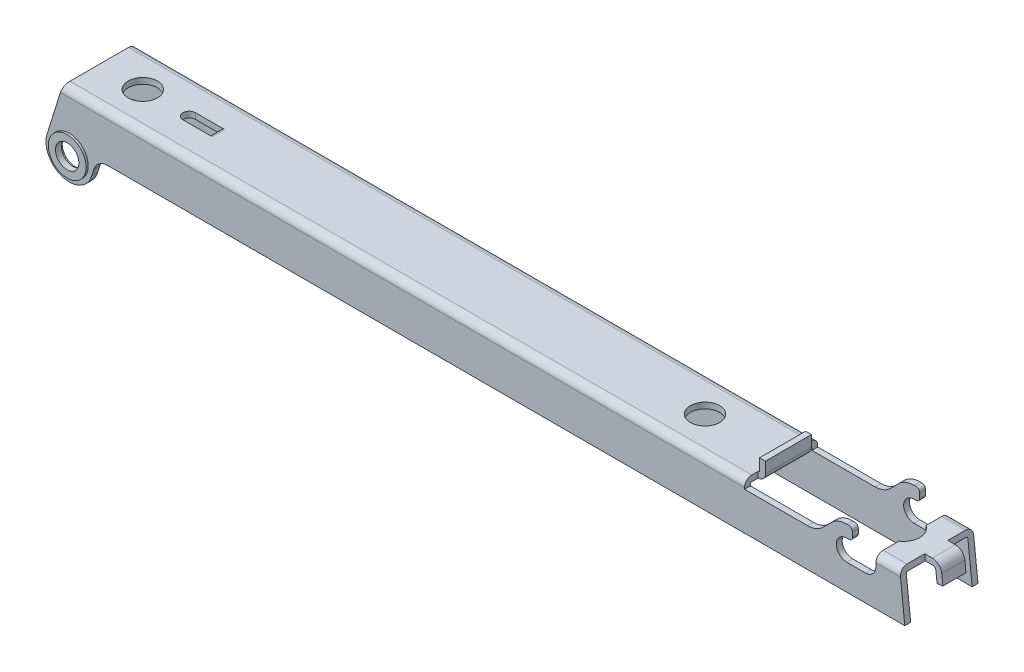
from build123d import *
from OCP.BRepFilletAPI import BRepFilletAPI_MakeFillet

# Parameters (mm, degrees)
BOSS_EXTRUDE1_DEPTH = 6.35
SKETCH2_R           = 3.2766
BOSS_EXTRUDE2_DEPTH = 0.381
FILLET1_R1          = 1.27
FILLET1_R2          = 2.54
SHELL1_T            = -1.016
BOSS_EXTRUDE3_DEPTH = 6.35
FILLET2_R           = 1.27
SHELL2_START        = 118.3386
SHELL2_DEPTH        = 27.813
SHELL2_START_2      = 129.293990182
SHELL2_2_DEPTH      = 7.764409818
FILLET3_R           = 0.635
SKETCH4_R           = 2.032
CUT_EXTRUDE1_DEPTH  = 148.431229717
EXTRUDE_THIN1_DEPTH = 2.0066
CUT_EXTRUDE2_DEPTH  = 150.225017324
EXTRUDE_THIN2_DEPTH = 4.0005
SKETCH8_R           = 2.54
CUT_EXTRUDE3_DEPTH  = 150.217877052
EXTRUDE_THIN3_DEPTH = 1.0795
FILLET4_R           = 0.635
FILLET6_RADIUS      = 1.0795
FILLET6_LENGTH      = 1.016


# Read off the part's stored shape, not the designer's step: Shell2
with BuildPart() as part:
    # Sketch1 → Boss-Extrude1 (new, symmetric)
    with BuildSketch(Plane.XY):
        with BuildLine():
            Line((0, 0), (118.3386, 0))
            Line((118.3386, 0), (118.3386, -8.128))
            Line((118.3386, -8.128), (5.974494608, -8.128))
            Line((5.974494608, -8.128), (5.047186378, -11.093494156))
            ThreePointArc((5.047186378, -11.093494156), (-0.044494156, -13.759386378), (-2.710386378, -8.667705844))
            Line((-2.710386378, -8.667705844), (0, 0))
        make_face()
    extrude(amount=BOSS_EXTRUDE1_DEPTH, both=True)

    # Sketch2 → Boss-Extrude2 (add)
    with BuildSketch(Plane.XY.offset(6.35)):
        with Locations(Location((1.1684, -9.8806, 0), (0, 0, 180))):
            Circle(SKETCH2_R)
    boss_extrude2 = extrude(amount=BOSS_EXTRUDE2_DEPTH)

    # Mirror1: Boss-Extrude2 across plane
    add(boss_extrude2.mirror(Plane.XY))

    # Fillet1: one fillet with a radius per group of edges: ONE call of the kernel's fillet builder (fillet() takes one radius for all edges)
    fillet1_edges_1 = [part.edges().sort_by_distance(p)[0] for p in [
        (59.1693, 0, 6.35),
        (59.1693, 0, -6.35),
    ]]
    fillet1_edges_2 = [part.edges().sort_by_distance(p)[0] for p in [
        (5.974494608, -8.128, 0),
    ]]
    fillet1 = BRepFilletAPI_MakeFillet(part.part.solid().wrapped)
    for e in fillet1_edges_1:
        fillet1.Add(FILLET1_R1, e.wrapped)
    for e in fillet1_edges_2:
        fillet1.Add(FILLET1_R2, e.wrapped)
    add(Compound.cast(fillet1.Shape()), mode=Mode.REPLACE)

    # Shell1
    shell1_openings = [part.faces().sort_by_distance(p)[0] for p in [
        (118.3386, -4.089523172, 0),
        (63.090062087, -8.128, 0),
        (5.232234532, -10.501717654, 0),
        (-0.044494156, -13.759386378, 0),
        (-1.363208192, -4.359484576, 0),
        (6.337175389, -8.621408996, 0),
    ]]
    offset(amount=SHELL1_T, openings=shell1_openings, kind=Kind.INTERSECTION)

    # Sketch3 → Boss-Extrude3 (add, symmetric)
    with BuildSketch(Plane.XY):
        with BuildLine():
            Line((118.3386, -8.128), (146.1516, -8.128))
            Line((146.1516, -8.128), (145.2626, 0.0762))
            Line((145.2626, 0.0762), (141.1224, 0.0762))
            Line((141.1224, 0.0762), (141.1224, -1.8034))
            ThreePointArc((141.1224, -1.8034), (140.594196369, -3.078596369), (139.319, -3.6068))
            Line((139.319, -3.6068), (136.0678, -3.6068))
            ThreePointArc((136.0678, -3.6068), (134.2644, -1.8034), (136.0678, 0))
            Line((136.0678, 0), (137.0584, 0))
            Line((137.0584, 0), (137.0584, 2.1082))
            Line((137.0584, 2.1082), (136.060885789, 2.1082))
            ThreePointArc((136.060885789, 2.1082), (134.588974152, 1.812396371), (133.345617268, 0.97091713))
            Line((133.345617268, 0.97091713), (132.009258703, -0.38671713))
            ThreePointArc((132.009258703, -0.38671713), (130.765901819, -1.228196371), (129.293990182, -1.524))
            Line((129.293990182, -1.524), (118.3386, -1.524))
            Line((118.3386, -1.524), (118.3386, -8.128))
        make_face()
    extrude(amount=BOSS_EXTRUDE3_DEPTH, both=True)

    # Fillet2
    fillet2_edges = [part.edges().sort_by_distance(p)[0] for p in [
        (143.1925, 0.0762, -6.35),
        (143.1925, 0.0762, 6.35),
    ]]
    fillet(fillet2_edges, radius=FILLET2_R)

    # Shell2 outline → Shell2 (cut)
    with BuildSketch(Plane.YZ.offset(SHELL2_START)):
        with BuildLine():
            Line((-8.128, 5.334), (-8.128, -5.334))
            Line((-8.128, -5.334), (-1.1938, -5.334))
            ThreePointArc((-1.1938, -5.334), (-1.014194878, -5.259605122), (-0.9398, -5.08))
            Line((-0.9398, -5.08), (-0.9398, 5.08))
            ThreePointArc((-0.9398, 5.08), (-1.014194878, 5.259605122), (-1.1938, 5.334))
            Line((-1.1938, 5.334), (-8.128, 5.334))
        make_face()
    extrude(amount=SHELL2_DEPTH, mode=Mode.SUBTRACT)

    # Shell2 2 outline → Shell2 2 (cut)
    with BuildSketch(Plane.YZ.offset(SHELL2_START_2)):
        with BuildLine():
            ThreePointArc((-1.1938, 5.334), (-1.014194878, 5.259605122), (-0.9398, 5.08))
            Line((-0.9398, 5.08), (-0.9398, -5.08))
            ThreePointArc((-0.9398, -5.08), (-1.014194878, -5.259605122), (-1.1938, -5.334))
            Line((-1.1938, -5.334), (2.1082, -5.334))
            Line((2.1082, -5.334), (2.1082, 5.334))
            Line((2.1082, 5.334), (-1.1938, 5.334))
        make_face()
    extrude(amount=SHELL2_2_DEPTH, mode=Mode.SUBTRACT)

    # Fillet3
    fillet3_edges = [part.edges().sort_by_distance(p)[0] for p in [
        (137.0584, 2.1082, -5.842),
        (137.0584, 0, -5.842),
        (137.0584, 0, 5.842),
        (137.0584, 2.1082, 5.842),
    ]]
    fillet(fillet3_edges, radius=FILLET3_R)

    # Sketch4 → Cut-Extrude1 (cut, through all)
    with BuildSketch(Plane.XY.offset(6.731)):
        with Locations((1.1684, -9.8806)):
            Circle(SKETCH4_R)
    extrude(amount=-CUT_EXTRUDE1_DEPTH, mode=Mode.SUBTRACT)

    # Sketch5 → Extrude-Thin1 (add, symmetric)
    with BuildSketch(Plane.XY):
        with BuildLine():
            Line((145.2626, 0.0762), (146.574836441, 0.0762))
            ThreePointArc((146.574836441, 0.0762), (147.677595365, -0.346091835), (148.216228196, -1.396940212))
            Line((148.216228196, -1.396940212), (148.412319576, -3.206583512))
            Line((148.412319576, -3.206583512), (147.402232341, -3.316035689))
            Line((147.402232341, -3.316035689), (147.206140962, -1.506392389))
            ThreePointArc((147.206140962, -1.506392389), (146.998974488, -1.102219937), (146.574836441, -0.9398))
            Line((146.574836441, -0.9398), (145.2626, -0.9398))
            Line((145.2626, -0.9398), (145.2626, 0.0762))
        make_face()
    extrude(amount=EXTRUDE_THIN1_DEPTH, both=True)

    # Sketch6 → Cut-Extrude2 (cut, through all)
    with BuildSketch(Plane(origin=(0, 0.0762, 0), x_dir=(1, 0, 0), z_dir=(0, 1, 0))):
        with BuildLine():
            Line((141.1224, 2.3495), (141.1224, -2.3495))
            ThreePointArc((141.1224, -2.3495), (142.3924, 0), (141.1224, 2.3495))
        make_face()
    extrude(amount=-CUT_EXTRUDE2_DEPTH, mode=Mode.SUBTRACT)

    # Sketch7 → Extrude-Thin2 (add, symmetric)
    with BuildSketch(Plane.XY):
        with BuildLine():
            ThreePointArc((118.3386, -1.016), (119.236625612, -0.644025612), (119.6086, 0.254))
            Line((119.6086, 0.254), (119.6086, 2.159))
            Line((119.6086, 2.159), (118.5926, 2.159))
            Line((118.5926, 2.159), (118.5926, 0.254))
            ThreePointArc((118.5926, 0.254), (118.518205122, 0.074394878), (118.3386, 0))
            Line((118.3386, 0), (118.3386, -1.016))
        make_face()
    extrude(amount=EXTRUDE_THIN2_DEPTH, both=True)

    # Sketch8 → Cut-Extrude3 (cut, through all)
    with BuildSketch(Plane(origin=(0, 0, 0), x_dir=(1, 0, 0), z_dir=(0, 1, 0))):
        with Locations(Location((7.556297414, 0, 0), (0, 0, 270))):
            Circle(SKETCH8_R)
        with Locations(Location((105.1306, 0, 0), (0, 0, 270))):
            Circle(SKETCH8_R)
        with BuildLine():
            Line((20.891297414, -1.0795), (20.891297414, 1.0795))
            Line((20.891297414, 1.0795), (15.620797414, 1.0795))
            ThreePointArc((15.620797414, 1.0795), (14.541297414, 0), (15.620797414, -1.0795))
            Line((15.620797414, -1.0795), (20.891297414, -1.0795))
        make_face()
    extrude(amount=-CUT_EXTRUDE3_DEPTH, mode=Mode.SUBTRACT)

    # Sketch9 → Extrude-Thin3 (add, symmetric)
    with BuildSketch(Plane.XY):
        Polygon((21.907297414, -1.016), (20.891297414, -1.016), (19.240297016, -3.3782), (14.795297016, -3.3782), (14.795297016, -2.3622), (18.710844734, -2.3622), (20.361845133, 0), (21.907297414, 0), align=None)
    extrude(amount=EXTRUDE_THIN3_DEPTH, both=True)

    # Fillet4
    fillet4_edges = [part.edges().sort_by_distance(p)[0] for p in [
        (20.891297414, -1.016, 0),
        (18.710844734, -2.3622, 0),
        (19.240297016, -3.3782, 0),
        (20.361845133, 0, 0),
    ]]
    fillet(fillet4_edges, radius=FILLET4_R)

    # Fillet6: full round fillet: the end face becomes a half cylinder, R = half its width
    fillet6_face = Plane((14.795297016, -2.8702, 0), x_dir=(0, -1, 0), z_dir=(-1, 0, 0))  # on the end face: x along it, z out of the body
    fillet6_slab = fillet6_face.offset(-FILLET6_RADIUS / 2) * Box(FILLET6_LENGTH, 2 * FILLET6_RADIUS, FILLET6_RADIUS, mode=Mode.PRIVATE)  # the body's end, R deep
    fillet6_round = Plane((15.874797016, -2.8702, 0), x_dir=(-1, 0, 0), z_dir=(0, -1, 0)) * Cylinder(FILLET6_RADIUS, FILLET6_LENGTH, mode=Mode.PRIVATE)  # its axis R under the face
    add(fillet6_slab - fillet6_round, mode=Mode.SUBTRACT)


solid = part.part
